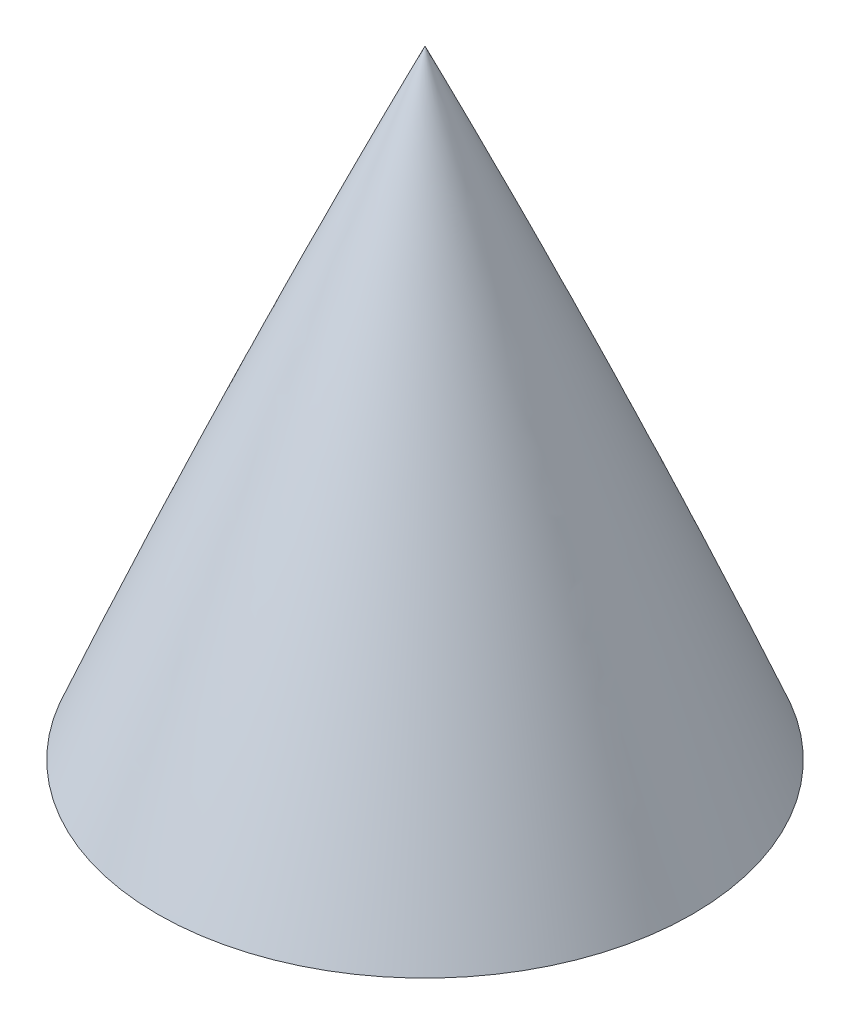
from build123d import *

# Parameters (mm, degrees)
SKETCH7_R          = 421.495799584
CUT_EXTRUDE2_DEPTH = 330.2
SKETCH8_R          = 3.175
CUT_EXTRUDE3_DEPTH = 12.7


with BuildPart() as part:
    # Sketch2 → Revolve1 (revolve)
    with BuildSketch(Plane.XY):
        with BuildLine():
            Line((-98.425, 0), (-90.551, 0))
            Line((-90.551, 0), (0, 0))
            Line((0, 0), (0, 375.92))
            Line((0, 375.92), (0, 381))
            ThreePointArc((0, 381), (-66.494117829, 194.964417939), (-98.425, 0))
        make_face()
    revolve(axis=Axis((0, 381, 0), (0, -1, 0)))

    # Sketch7 → Cut-Extrude2 (cut)
    with BuildSketch(Plane.XZ):
        with Locations((-188.314971498, 83.017725001)):
            Circle(SKETCH7_R)
    extrude(amount=-CUT_EXTRUDE2_DEPTH, mode=Mode.SUBTRACT)

    # Sketch8 → Cut-Extrude3 (cut)
    with BuildSketch(Plane(origin=(0, 330.2, 0), x_dir=(-1, 0, 0), z_dir=(0, -1, 0))):
        Circle(SKETCH8_R)
    extrude(amount=-CUT_EXTRUDE3_DEPTH, mode=Mode.SUBTRACT)


solid = part.part
